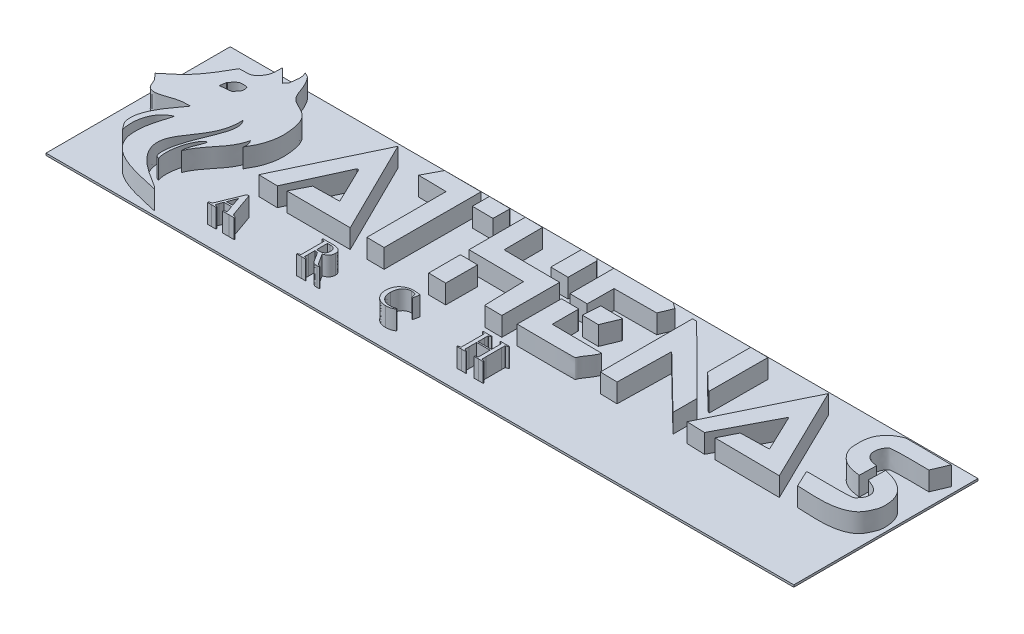
from build123d import *

# Parameters (mm, degrees)
RESSALTO_EXTRUS_O1_DEPTH = 100
ESBO_O2_W                = 3556.853307126
ESBO_O2_H                = 876
RESSALTO_EXTRUS_O2_DEPTH = 10


# Read off the part's stored shape, not the designer's step: Ressalto-extrusão1
with BuildPart() as part:
    # Ressalto-extrusão1 outline → Ressalto-extrusão1 (new body)
    # profile 1 of 19: a face of its own
    with BuildSketch(Plane(origin=(0, 0, 0), x_dir=(1, 0, 0), z_dir=(0, 1, 0))):
        Polygon((883, 903), (669, 455), (759, 453), (878, 713), (886, 714), (971, 538), (844, 536), (803, 455), (1105, 454), align=None)
    # profile 2 of 19: a face of its own
    with BuildSketch(Plane(origin=(0, 0, 0), x_dir=(1, 0, 0), z_dir=(0, 1, 0))):
        with BuildLine():
            Line((1878.015170723, 246.674179847), (1878.015170723, 282.090846514))
            Line((1878.015170723, 282.090846514), (1941.999545723, 282.090846514))
            Line((1941.999545723, 282.090846514), (1941.999545723, 246.674179847))
            add(Edge.make_bspline(
                [(1941.843295723, 228.44501318), (1941.871549038, 229.747058632), (1941.931253677, 232.498528782), (1941.978689804, 236.839000918), (1942.005544746, 241.613380188), (1942.001603698, 244.938064601), (1941.999545723, 246.674179847)],
                knots=[0, 0, 0, 0, 0.21431488, 0.45288818, 0.71430396, 1, 1, 1, 1], degree=3))
            add(Edge.make_bspline(
                [(1939.551629057, 225.32001318), (1939.884181692, 225.446781382), (1940.517257151, 225.688108105), (1941.282415936, 226.390246164), (1941.731302047, 227.351390915), (1941.804585515, 228.067006612), (1941.843295723, 228.44501318)],
                knots=[0, 0, 0, 0, 0.254504466, 0.484496332, 0.727697738, 1, 1, 1, 1], degree=3))
            Line((1939.551629057, 225.32001318), (1929.60371239, 222.090846514))
            Line((1929.60371239, 222.090846514), (1929.968295723, 218.75751318))
            add(Edge.make_bspline(
                [(1950.437045723, 219.017929847), (1946.990692238, 219.014077886), (1940.166762016, 219.006450836), (1933.344865738, 218.839932968), (1929.968295723, 218.75751318)],
                knots=[0, 0, 0, 0, 0.505039379, 1, 1, 1, 1], degree=3))
            add(Edge.make_bspline(
                [(1972.598504057, 218.75751318), (1968.813933778, 218.840074993), (1961.427641986, 219.001209705), (1954.039613895, 219.012449212), (1950.437045723, 219.017929847)],
                knots=[0, 0, 0, 0, 0.512377575, 1, 1, 1, 1], degree=3))
            Line((1972.598504057, 218.75751318), (1972.41621239, 222.090846514))
            Line((1972.41621239, 222.090846514), (1961.79121239, 225.424179847))
            add(Edge.make_bspline(
                [(1959.421420723, 228.21063818), (1959.460063252, 227.883491082), (1959.534090713, 227.256775664), (1960.011188337, 226.413944588), (1960.799141615, 225.790868198), (1961.443326431, 225.552765158), (1961.79121239, 225.424179847)],
                knots=[0, 0, 0, 0, 0.249515806, 0.477997218, 0.718097301, 1, 1, 1, 1], degree=3))
            add(Edge.make_bspline(
                [(1959.239129057, 246.075221514), (1959.233763758, 244.382481349), (1959.223445572, 241.127115351), (1959.294048758, 236.457192392), (1959.332148527, 232.194696579), (1959.392634458, 229.495317681), (1959.421420723, 228.21063818)],
                knots=[0, 0, 0, 0, 0.284234276, 0.546620572, 0.784229158, 1, 1, 1, 1], degree=3))
            Line((1959.239129057, 246.075221514), (1959.239129057, 318.939804847))
            add(Edge.make_bspline(
                [(1959.421420723, 333.861679847), (1959.3925923, 332.811385442), (1959.331368133, 330.580829909), (1959.294035389, 327.038729626), (1959.223258914, 323.115380094), (1959.233685187, 320.372135295), (1959.239129057, 318.939804847)],
                knots=[0, 0, 0, 0, 0.21121017, 0.448556149, 0.712074614, 1, 1, 1, 1], degree=3))
            add(Edge.make_bspline(
                [(1961.530795723, 336.908554847), (1961.221936578, 336.781972542), (1960.620011599, 336.535280636), (1959.953829398, 335.808951181), (1959.502440935, 334.905961746), (1959.449503336, 334.223640943), (1959.421420723, 333.861679847)],
                knots=[0, 0, 0, 0, 0.249768632, 0.486765506, 0.727736691, 1, 1, 1, 1], degree=3))
            Line((1961.530795723, 336.908554847), (1972.598504057, 340.424179847))
            Line((1972.598504057, 340.424179847), (1972.233920723, 343.75751318))
            add(Edge.make_bspline(
                [(1950.801629057, 343.418971514), (1954.326160708, 343.430597377), (1961.471658149, 343.454167198), (1968.614367694, 343.655492173), (1972.233920723, 343.75751318)],
                knots=[0, 0, 0, 0, 0.493252105, 1, 1, 1, 1], degree=3))
            add(Edge.make_bspline(
                [(1929.60371239, 343.75751318), (1933.162498292, 343.655501842), (1940.227044377, 343.452999129), (1947.29444989, 343.430257153), (1950.801629057, 343.418971514)],
                knots=[0, 0, 0, 0, 0.503752946, 1, 1, 1, 1], degree=3))
            Line((1929.60371239, 343.75751318), (1929.786004057, 340.424179847))
            Line((1929.786004057, 340.424179847), (1939.551629057, 337.27313818))
            add(Edge.make_bspline(
                [(1941.843295723, 334.486679847), (1941.805316282, 334.830834308), (1941.733448231, 335.482073756), (1941.269748922, 336.347517962), (1940.500443038, 336.955213244), (1939.881956831, 337.162453221), (1939.551629057, 337.27313818)],
                knots=[0, 0, 0, 0, 0.264628268, 0.500752965, 0.733356767, 1, 1, 1, 1], degree=3))
            add(Edge.make_bspline(
                [(1941.999545723, 319.278346514), (1942.001518322, 320.684600846), (1942.005341795, 323.410332243), (1941.97872342, 327.351398556), (1941.929887404, 331.0147869), (1941.871439637, 333.358249805), (1941.843295723, 334.486679847)],
                knots=[0, 0, 0, 0, 0.277372475, 0.537628824, 0.77735789, 1, 1, 1, 1], degree=3))
            Line((1941.999545723, 319.278346514), (1941.999545723, 288.75751318))
            Line((1941.999545723, 288.75751318), (1878.015170723, 288.75751318))
            Line((1878.015170723, 288.75751318), (1878.015170723, 319.278346514))
            add(Edge.make_bspline(
                [(1878.19746239, 334.486679847), (1878.168710041, 333.358255809), (1878.108998708, 331.014805373), (1878.070490433, 327.351229449), (1877.999772761, 323.410512657), (1878.009930385, 320.684633094), (1878.015170723, 319.278346514)],
                knots=[0, 0, 0, 0, 0.222638348, 0.462363364, 0.722632212, 1, 1, 1, 1], degree=3))
            add(Edge.make_bspline(
                [(1880.489129057, 337.27313818), (1880.158801282, 337.162453221), (1879.540315075, 336.955213244), (1878.771009191, 336.347517962), (1878.307309883, 335.482073756), (1878.235441831, 334.830834308), (1878.19746239, 334.486679847)],
                knots=[0, 0, 0, 0, 0.266643233, 0.499247035, 0.735371732, 1, 1, 1, 1], degree=3))
            Line((1880.489129057, 337.27313818), (1890.515170723, 340.424179847))
            Line((1890.515170723, 340.424179847), (1890.07246239, 343.75751318))
            add(Edge.make_bspline(
                [(1869.239129057, 343.418971514), (1872.737647899, 343.429386503), (1879.68359611, 343.45006439), (1886.626529396, 343.655534013), (1890.07246239, 343.75751318)],
                knots=[0, 0, 0, 0, 0.503677646, 1, 1, 1, 1], degree=3))
            add(Edge.make_bspline(
                [(1847.442254057, 343.75751318), (1851.148617326, 343.655483408), (1858.412903448, 343.455510172), (1865.679885691, 343.430984008), (1869.239129057, 343.418971514)],
                knots=[0, 0, 0, 0, 0.510217137, 1, 1, 1, 1], degree=3))
            Line((1847.442254057, 343.75751318), (1847.624545723, 340.424179847))
            Line((1847.624545723, 340.424179847), (1858.50996239, 336.908554847))
            add(Edge.make_bspline(
                [(1860.61933739, 333.861679847), (1860.591254777, 334.223640943), (1860.538317178, 334.905961746), (1860.086928715, 335.808951181), (1859.420746514, 336.535280636), (1858.818821535, 336.781972542), (1858.50996239, 336.908554847)],
                knots=[0, 0, 0, 0, 0.272263309, 0.513234494, 0.750231368, 1, 1, 1, 1], degree=3))
            add(Edge.make_bspline(
                [(1860.801629057, 318.939804847), (1860.807072926, 320.372135295), (1860.817499199, 323.115380094), (1860.746722724, 327.038729626), (1860.709389981, 330.580829909), (1860.648165814, 332.811385442), (1860.61933739, 333.861679847)],
                knots=[0, 0, 0, 0, 0.287925386, 0.551443851, 0.78878983, 1, 1, 1, 1], degree=3))
            Line((1860.801629057, 318.939804847), (1860.801629057, 246.075221514))
            add(Edge.make_bspline(
                [(1860.61933739, 228.21063818), (1860.648123655, 229.495317681), (1860.708609586, 232.194696579), (1860.746709355, 236.457192392), (1860.817312541, 241.127115351), (1860.806994355, 244.382481349), (1860.801629057, 246.075221514)],
                knots=[0, 0, 0, 0, 0.215770842, 0.453379428, 0.715765724, 1, 1, 1, 1], degree=3))
            add(Edge.make_bspline(
                [(1858.249545723, 225.424179847), (1858.597431682, 225.552765158), (1859.241616498, 225.790868198), (1860.029569776, 226.413944588), (1860.506667401, 227.256775664), (1860.580694861, 227.883491082), (1860.61933739, 228.21063818)],
                knots=[0, 0, 0, 0, 0.281902699, 0.522002782, 0.750484194, 1, 1, 1, 1], degree=3))
            Line((1858.249545723, 225.424179847), (1847.442254057, 222.090846514))
            Line((1847.442254057, 222.090846514), (1847.780795723, 218.75751318))
            add(Edge.make_bspline(
                [(1869.577670723, 219.017929847), (1866.01850038, 219.012644276), (1858.751977944, 219.001853075), (1851.487238262, 218.840059597), (1847.780795723, 218.75751318)],
                knots=[0, 0, 0, 0, 0.489803806, 1, 1, 1, 1], degree=3))
            add(Edge.make_bspline(
                [(1890.515170723, 218.75751318), (1887.025749337, 218.839978861), (1880.047554139, 219.004894917), (1873.067415943, 219.013585139), (1869.577670723, 219.017929847)],
                knots=[0, 0, 0, 0, 0.5000464, 1, 1, 1, 1], degree=3))
            Line((1890.515170723, 218.75751318), (1890.22871239, 222.090846514))
            Line((1890.22871239, 222.090846514), (1880.489129057, 225.32001318))
            add(Edge.make_bspline(
                [(1878.19746239, 228.44501318), (1878.236172598, 228.067006612), (1878.309456066, 227.351390915), (1878.758342178, 226.390246164), (1879.523500962, 225.688108105), (1880.156576422, 225.446781382), (1880.489129057, 225.32001318)],
                knots=[0, 0, 0, 0, 0.272302262, 0.515503668, 0.745495534, 1, 1, 1, 1], degree=3))
            add(Edge.make_bspline(
                [(1878.015170723, 246.674179847), (1878.009719055, 244.938036784), (1877.999278814, 241.613227949), (1878.070421684, 236.83914054), (1878.107733217, 232.498514264), (1878.168640135, 229.747053969), (1878.19746239, 228.44501318)],
                knots=[0, 0, 0, 0, 0.285692695, 0.547117122, 0.785687629, 1, 1, 1, 1], degree=3))
        make_face()
    # profile 3 of 19: a face of its own
    with BuildSketch(Plane(origin=(0, 0, 0), x_dir=(1, 0, 0), z_dir=(0, 1, 0))):
        with BuildLine():
            Line((1538.679570268, 313.418971514), (1542.195195268, 313.965846514))
            Line((1542.195195268, 313.965846514), (1547.637903601, 342.715846514))
            Line((1547.637903601, 342.715846514), (1547.012903601, 343.44501318))
            add(Edge.make_bspline(
                [(1516.622278601, 347.090846514), (1519.115083042, 347.043046842), (1524.13560967, 346.946777947), (1531.700997682, 346.243106718), (1539.35364026, 345.107830761), (1544.440260002, 344.003531254), (1547.012903601, 343.44501318)],
                knots=[0, 0, 0, 0, 0.243796665, 0.491008291, 0.742568871, 1, 1, 1, 1], degree=3))
            add(Edge.make_bspline(
                [(1446.335820268, 280.892929847), (1446.394883543, 283.378447284), (1446.510122958, 288.227984944), (1447.435870547, 295.301894795), (1448.961089063, 301.980577948), (1451.129062736, 308.257334025), (1453.89991718, 314.143789778), (1457.312611957, 319.612714829), (1461.321019589, 324.704179154), (1465.935302996, 329.346067018), (1471.018311539, 333.517802354), (1476.48976503, 337.171579356), (1482.337367658, 340.210872157), (1488.50619859, 342.763198117), (1495.044032894, 344.710776624), (1501.932041727, 346.077619852), (1509.161715247, 346.929205575), (1514.102527999, 347.036253471), (1516.622278601, 347.090846514)],
                knots=[0, 0, 0, 0, 0.06853161, 0.133713253, 0.196375687, 0.257173194, 0.316502542, 0.375429113, 0.434580918, 0.494848644, 0.55557446, 0.615666939, 0.675957486, 0.737044672, 0.799532613, 0.86376334, 0.930521066, 1, 1, 1, 1], degree=3))
            add(Edge.make_bspline(
                [(1510.554570268, 217.090846514), (1508.243298555, 217.148541016), (1503.710545208, 217.261688658), (1497.073664014, 218.070450106), (1490.768347283, 219.447107204), (1484.799440009, 221.389603521), (1479.130989251, 223.834816503), (1473.801551918, 226.873094939), (1468.800446799, 230.460198921), (1464.182499392, 234.569060032), (1459.989849637, 239.11254026), (1456.325018061, 244.050654407), (1453.2410227, 249.349667922), (1450.690536752, 254.980859797), (1448.749185883, 260.977874575), (1447.341450398, 267.306216223), (1446.497705604, 273.986483515), (1446.390611354, 278.555400654), (1446.335820268, 280.892929847)],
                knots=[0, 0, 0, 0, 0.068091714, 0.133538147, 0.196650532, 0.257959557, 0.31820952, 0.378231045, 0.43834949, 0.499223778, 0.560043236, 0.620200297, 0.68003407, 0.740361072, 0.801992546, 0.86540996, 0.931141639, 1, 1, 1, 1], degree=3))
            add(Edge.make_bspline(
                [(1549.747278601, 228.36688818), (1548.292848223, 227.468105227), (1545.397975418, 225.679183345), (1540.838591859, 223.39247524), (1536.145593813, 221.425537738), (1531.293442597, 219.838240062), (1526.30251896, 218.619117446), (1521.179757587, 217.725860736), (1515.912799237, 217.20088493), (1512.352599517, 217.127771455), (1510.554570268, 217.090846514)],
                knots=[0, 0, 0, 0, 0.123953266, 0.246714413, 0.369483633, 0.492723333, 0.616561425, 0.741803105, 0.869601256, 1, 1, 1, 1], degree=3))
            Line((1549.747278601, 228.36688818), (1548.783736934, 232.090846514))
            add(Edge.make_bspline(
                [(1519.330611934, 227.090846514), (1521.694832729, 227.152423132), (1526.501846613, 227.2776228), (1533.795922111, 228.277108937), (1541.281432443, 229.811484572), (1546.250841142, 231.321298133), (1548.783736934, 232.090846514)],
                knots=[0, 0, 0, 0, 0.236425849, 0.480709052, 0.735318639, 1, 1, 1, 1], degree=3))
            add(Edge.make_bspline(
                [(1466.335820268, 284.043971514), (1466.368907658, 281.932497675), (1466.433629961, 277.802239996), (1467.140726436, 271.779286977), (1468.210291444, 266.076358162), (1469.755129184, 260.706282805), (1471.726764335, 255.657270459), (1474.172430133, 250.948530532), (1477.008267028, 246.534501222), (1480.320815876, 242.516971421), (1483.992776055, 238.870076977), (1488.045994474, 235.715808456), (1492.431803849, 233.023805286), (1497.173798479, 230.874100199), (1502.234321517, 229.171650299), (1507.633455321, 227.951126654), (1513.372526259, 227.21262978), (1517.31448037, 227.132056241), (1519.330611934, 227.090846514)],
                knots=[0, 0, 0, 0, 0.071933868, 0.140709965, 0.206394407, 0.269508485, 0.330877952, 0.390821605, 0.450071989, 0.509358559, 0.567938108, 0.626115806, 0.684012213, 0.742925534, 0.803178701, 0.86569285, 0.931307956, 1, 1, 1, 1], degree=3))
            add(Edge.make_bspline(
                [(1512.481653601, 338.75751318), (1510.733891306, 338.718065359), (1507.317843445, 338.640963543), (1502.348529678, 337.876373879), (1497.649707859, 336.728223162), (1493.239174973, 335.052102685), (1489.135957467, 332.868333706), (1485.290998301, 330.252346162), (1481.762980565, 327.12442557), (1478.554134045, 323.554212878), (1475.649894146, 319.633987787), (1473.200128084, 315.35169825), (1471.027474226, 310.844605502), (1469.332246129, 306.015092132), (1467.953387535, 300.927867061), (1467.061058642, 295.543426717), (1466.41534049, 289.892905913), (1466.3627555, 286.025133055), (1466.335820268, 284.043971514)],
                knots=[0, 0, 0, 0, 0.064984085, 0.127013122, 0.186625522, 0.244690157, 0.302048039, 0.35920369, 0.417327582, 0.477009063, 0.537538362, 0.598473028, 0.660307519, 0.723443352, 0.788625386, 0.856167663, 0.926325794, 1, 1, 1, 1], degree=3))
            add(Edge.make_bspline(
                [(1532.247278601, 336.075221514), (1530.480744844, 336.48766324), (1527.04319915, 337.290244721), (1521.960943413, 338.09892105), (1517.13891823, 338.673551981), (1514.002304635, 338.730098873), (1512.481653601, 338.75751318)],
                knots=[0, 0, 0, 0, 0.272119475, 0.529524628, 0.771910425, 1, 1, 1, 1], degree=3))
            Line((1532.247278601, 336.075221514), (1538.679570268, 313.418971514))
        make_face()
    # profile 4 of 19: a face of its own
    with BuildSketch(Plane(origin=(0, 0, 0), x_dir=(1, 0, 0), z_dir=(0, 1, 0))):
        with BuildLine():
            add(Edge.make_bspline(
                [(1115.292871132, 245.346054847), (1115.301926797, 243.696751535), (1115.319132586, 240.563070418), (1115.337846767, 236.101136451), (1115.387705082, 232.090519709), (1115.447028034, 229.564764144), (1115.475162798, 228.36688818)],
                knots=[0, 0, 0, 0, 0.291392183, 0.553645999, 0.788310185, 1, 1, 1, 1], degree=3))
            Line((1115.292871132, 245.346054847), (1115.292871132, 275.580429847))
            Line((1115.292871132, 275.580429847), (1121.594954465, 275.424179847))
            add(Edge.make_bspline(
                [(1132.558496132, 269.07001318), (1132.139108325, 269.68207724), (1131.390832693, 270.774127637), (1130.290396041, 272.208854111), (1129.284079099, 273.356229103), (1128.156216558, 274.185249184), (1126.883255672, 274.780869351), (1125.396508013, 275.133897058), (1123.613302779, 275.323722369), (1122.315908628, 275.388296429), (1121.594954465, 275.424179847)],
                knots=[0, 0, 0, 0, 0.164686996, 0.293836072, 0.401580084, 0.502192456, 0.602212332, 0.711598774, 0.839737165, 1, 1, 1, 1], degree=3))
            add(Edge.make_bspline(
                [(1164.329329465, 223.002304847), (1163.694495012, 223.476435569), (1162.380229689, 224.458004171), (1160.528476474, 226.228370466), (1158.720489962, 228.298041939), (1156.219067746, 231.487945766), (1153.158336741, 236.045563874), (1149.363821047, 241.968872083), (1145.446740492, 248.428204849), (1141.384184752, 255.252156203), (1137.16965, 262.241551431), (1134.097430038, 266.791071377), (1132.558496132, 269.07001318)],
                knots=[0, 0, 0, 0, 0.042266959, 0.087503125, 0.136413548, 0.188882247, 0.30379449, 0.429250458, 0.564431838, 0.707000012, 0.853230686, 1, 1, 1, 1], degree=3))
            add(Edge.make_bspline(
                [(1183.105371132, 218.75751318), (1181.976990727, 218.773042469), (1179.858615734, 218.802196516), (1176.866659344, 218.870697745), (1174.230427291, 219.134353548), (1171.87967977, 219.532641644), (1169.78050468, 220.154011253), (1167.836066063, 220.871624877), (1166.030454241, 221.840281322), (1164.904053929, 222.609715569), (1164.329329465, 223.002304847)],
                knots=[0, 0, 0, 0, 0.172540607, 0.323920644, 0.457290372, 0.57729378, 0.687760602, 0.791519124, 0.893626574, 1, 1, 1, 1], degree=3))
            add(Edge.make_bspline(
                [(1193.730371132, 219.330429847), (1192.715331298, 219.23502648), (1190.782556686, 219.053365425), (1187.992406135, 218.926543075), (1185.468294715, 218.760976621), (1183.860823162, 218.75862048), (1183.105371132, 218.75751318)],
                knots=[0, 0, 0, 0, 0.28729657, 0.547051946, 0.787131208, 1, 1, 1, 1], degree=3))
            Line((1193.730371132, 219.330429847), (1193.469954465, 222.090846514))
            add(Edge.make_bspline(
                [(1179.954329465, 228.783554847), (1180.441923701, 228.30709097), (1181.384377034, 227.386151105), (1182.880608708, 226.165786804), (1184.432202894, 225.173481507), (1186.042345715, 224.34185073), (1187.750868096, 223.728147172), (1189.516930949, 223.091918416), (1191.443170039, 222.593905819), (1192.775345426, 222.263252388), (1193.469954465, 222.090846514)],
                knots=[0, 0, 0, 0, 0.133306653, 0.257663627, 0.376812079, 0.492983951, 0.6112217, 0.731489845, 0.859996227, 1, 1, 1, 1], degree=3))
            add(Edge.make_bspline(
                [(1146.438704465, 279.017929847), (1148.296664084, 276.260297669), (1151.920343361, 270.881938271), (1156.901841092, 262.8618219), (1161.571921027, 255.368644969), (1165.234210781, 249.488930211), (1168.012089023, 245.136616466), (1169.967142707, 242.148588685), (1171.811661531, 239.341954014), (1173.542277701, 236.724304947), (1175.233481377, 234.366739018), (1176.832709867, 232.244341513), (1178.405530506, 230.415446524), (1179.455411401, 229.309239753), (1179.954329465, 228.783554847)],
                knots=[0, 0, 0, 0, 0.164993408, 0.32179558, 0.468460144, 0.603161316, 0.665538051, 0.724680569, 0.780356486, 0.832208226, 0.880381188, 0.924321707, 0.964036618, 1, 1, 1, 1], degree=3))
            add(Edge.make_bspline(
                [(1175.292871132, 313.497096514), (1175.274874983, 312.411268619), (1175.239510339, 310.277483374), (1174.903039185, 307.157093765), (1174.312283018, 304.204662818), (1173.584410786, 301.391223875), (1172.547578853, 298.76081548), (1171.331016902, 296.264892699), (1169.858210023, 293.945718741), (1168.18987584, 291.76162368), (1166.259872499, 289.758416344), (1164.139912199, 287.837211555), (1161.774893424, 286.043105501), (1159.146151153, 284.406875738), (1156.306283707, 282.877448069), (1153.245769413, 281.431645183), (1149.938065206, 280.132166398), (1147.623809097, 279.395280739), (1146.438704465, 279.017929847)],
                knots=[0, 0, 0, 0, 0.066648492, 0.130972477, 0.192322563, 0.251401682, 0.309099439, 0.365583418, 0.421620656, 0.477475148, 0.53401943, 0.592129179, 0.65298893, 0.715974451, 0.78202584, 0.850922516, 0.92365909, 1, 1, 1, 1], degree=3))
            add(Edge.make_bspline(
                [(1134.303287798, 343.75751318), (1135.961977135, 343.732335216), (1139.17070354, 343.683628568), (1143.822811774, 343.315461535), (1148.154572981, 342.723241353), (1152.174483207, 341.909380404), (1155.866296045, 340.810414452), (1159.241385745, 339.483981726), (1162.31499531, 337.935344008), (1165.032288032, 336.091308762), (1167.459973602, 334.055895753), (1169.551435335, 331.773633523), (1171.344091736, 329.277864804), (1172.813071496, 326.550514888), (1173.935685715, 323.589292396), (1174.695105541, 320.410458738), (1175.220199841, 317.030031549), (1175.268186387, 314.697152282), (1175.292871132, 313.497096514)],
                knots=[0, 0, 0, 0, 0.085871209, 0.166117433, 0.241436107, 0.312127298, 0.378249033, 0.440592444, 0.499687396, 0.556029941, 0.610238405, 0.663357187, 0.715864025, 0.768950475, 0.823289199, 0.879317174, 0.937919581, 1, 1, 1, 1], degree=3))
            Line((1134.303287798, 343.75751318), (1121.100162798, 343.75751318))
            add(Edge.make_bspline(
                [(1107.532454465, 343.418971514), (1108.348525637, 343.423214415), (1110.1722049, 343.432696052), (1113.226881604, 343.560042191), (1116.932409941, 343.702618426), (1119.632967055, 343.738188294), (1121.100162798, 343.75751318)],
                knots=[0, 0, 0, 0, 0.180367081, 0.403067425, 0.675690276, 1, 1, 1, 1], degree=3))
            add(Edge.make_bspline(
                [(1085.266829465, 343.75751318), (1089.007918708, 343.655500434), (1096.428438932, 343.45315625), (1103.851676233, 343.430303129), (1107.532454465, 343.418971514)],
                knots=[0, 0, 0, 0, 0.504154578, 1, 1, 1, 1], degree=3))
            Line((1085.266829465, 343.75751318), (1085.449121132, 340.424179847))
            Line((1085.449121132, 340.424179847), (1096.334537798, 336.908554847))
            add(Edge.make_bspline(
                [(1098.443912798, 333.861679847), (1098.415830185, 334.223640943), (1098.362892587, 334.905961746), (1097.911504124, 335.808951181), (1097.245321923, 336.535280636), (1096.643396944, 336.781972542), (1096.334537798, 336.908554847)],
                knots=[0, 0, 0, 0, 0.272263309, 0.513234494, 0.750231368, 1, 1, 1, 1], degree=3))
            add(Edge.make_bspline(
                [(1098.626204465, 318.939804847), (1098.631789045, 320.38949756), (1098.642390161, 323.141425214), (1098.571422372, 327.064773172), (1098.533661307, 330.589505598), (1098.47272006, 332.811385179), (1098.443912798, 333.861679847)],
                knots=[0, 0, 0, 0, 0.291415291, 0.553188817, 0.788789903, 1, 1, 1, 1], degree=3))
            Line((1098.626204465, 318.939804847), (1098.626204465, 246.075221514))
            add(Edge.make_bspline(
                [(1098.443912798, 228.21063818), (1098.472708042, 229.477955874), (1098.533449865, 232.151285762), (1098.571449006, 236.387747082), (1098.642158467, 241.075030189), (1098.631688547, 244.3564389), (1098.626204465, 246.075221514)],
                knots=[0, 0, 0, 0, 0.212856073, 0.449006989, 0.711393096, 1, 1, 1, 1], degree=3))
            add(Edge.make_bspline(
                [(1096.074121132, 225.424179847), (1096.404665161, 225.544818485), (1097.032331318, 225.773897771), (1097.799291446, 226.395327473), (1098.311000527, 227.232470719), (1098.398095641, 227.873446946), (1098.443912798, 228.21063818)],
                knots=[0, 0, 0, 0, 0.268089007, 0.509071053, 0.741742469, 1, 1, 1, 1], degree=3))
            Line((1096.074121132, 225.424179847), (1085.266829465, 222.090846514))
            Line((1085.266829465, 222.090846514), (1085.605371132, 218.75751318))
            add(Edge.make_bspline(
                [(1107.141829465, 219.017929847), (1103.61737827, 219.012742241), (1096.437646744, 219.002174462), (1089.259728368, 218.840051675), (1085.605371132, 218.75751318)],
                knots=[0, 0, 0, 0, 0.490888995, 1, 1, 1, 1], degree=3))
            add(Edge.make_bspline(
                [(1127.792871132, 218.75751318), (1124.329493378, 218.840005517), (1117.446781764, 219.003941132), (1110.562128125, 219.013286877), (1107.141829465, 219.017929847)],
                knots=[0, 0, 0, 0, 0.503199603, 1, 1, 1, 1], degree=3))
            Line((1127.792871132, 218.75751318), (1127.506412798, 222.090846514))
            Line((1127.506412798, 222.090846514), (1117.766829465, 224.955429847))
            add(Edge.make_bspline(
                [(1115.475162798, 228.36688818), (1115.51287209, 227.953954158), (1115.583617246, 227.179262273), (1116.034875694, 226.14159359), (1116.778356228, 225.347187349), (1117.43122438, 225.08843882), (1117.766829465, 224.955429847)],
                knots=[0, 0, 0, 0, 0.280856458, 0.526905527, 0.756807082, 1, 1, 1, 1], degree=3))
        make_face()
        with BuildLine():
            add(Edge.make_bspline(
                [(1115.292871132, 284.017929847), (1117.046128719, 283.948712128), (1120.413013398, 283.815789232), (1123.782272656, 283.776393934), (1125.397037798, 283.75751318)],
                knots=[0, 0, 0, 0, 0.52073586, 1, 1, 1, 1], degree=3))
            Line((1115.292871132, 284.017929847), (1115.292871132, 334.721054847))
            add(Edge.make_bspline(
                [(1126.829329465, 335.424179847), (1125.96980506, 335.411718476), (1124.180475742, 335.385776807), (1121.402178715, 335.246434334), (1118.413906342, 335.045410437), (1116.359994519, 334.831956331), (1115.292871132, 334.721054847)],
                knots=[0, 0, 0, 0, 0.223017818, 0.464271075, 0.721658516, 1, 1, 1, 1], degree=3))
            add(Edge.make_bspline(
                [(1155.292871132, 310.111679847), (1155.277402034, 311.171877369), (1155.247392339, 313.22863634), (1154.888339713, 316.194598335), (1154.388116523, 318.954569072), (1153.64004269, 321.492523946), (1152.639619427, 323.788704415), (1151.468208226, 325.885312229), (1150.04608583, 327.741169132), (1148.418677503, 329.404798803), (1146.550118755, 330.846610884), (1144.442208213, 332.070746614), (1142.102908259, 333.116710017), (1139.521381722, 333.972991022), (1136.68511506, 334.614975944), (1133.612345103, 335.074536965), (1130.29832572, 335.36374395), (1128.010499746, 335.403601824), (1126.829329465, 335.424179847)],
                knots=[0, 0, 0, 0, 0.072331686, 0.140321818, 0.203659703, 0.263652261, 0.320451949, 0.374326436, 0.427184364, 0.479561815, 0.532780552, 0.587761447, 0.645581267, 0.707418407, 0.773107569, 0.843838994, 0.919376412, 1, 1, 1, 1], degree=3))
            add(Edge.make_bspline(
                [(1125.397037798, 283.75751318), (1126.647551133, 283.778698232), (1129.065200634, 283.819655835), (1132.554920391, 284.098546553), (1135.785651305, 284.588681645), (1138.753885587, 285.291086113), (1141.481478662, 286.165264319), (1143.948796924, 287.257928673), (1146.14711115, 288.566890739), (1148.112965543, 290.063060899), (1149.812635471, 291.797925302), (1151.286770034, 293.752096366), (1152.54452536, 295.926421048), (1153.55534056, 298.335375354), (1154.331913496, 300.966439767), (1154.903819243, 303.81496697), (1155.242732695, 306.891640511), (1155.275827096, 309.017061216), (1155.292871132, 310.111679847)],
                knots=[0, 0, 0, 0, 0.081605276, 0.157769572, 0.228273606, 0.294639421, 0.356622281, 0.41494546, 0.470322065, 0.523236111, 0.575711686, 0.628281963, 0.682596601, 0.739202578, 0.798345327, 0.861337315, 0.928586958, 1, 1, 1, 1], degree=3))
        make_face(mode=Mode.SUBTRACT)
    # profile 5 of 19: a face of its own
    with BuildSketch(Plane(origin=(0, 0, 0), x_dir=(1, 0, 0), z_dir=(0, 1, 0))):
        with BuildLine():
            Line((693.626956929, 242.19501318), (699.876956929, 258.75751318))
            Line((699.876956929, 258.75751318), (735.892581929, 258.75751318))
            Line((735.892581929, 258.75751318), (741.699873596, 242.19501318))
            add(Edge.make_bspline(
                [(745.137373596, 230.00751318), (745.090350641, 230.696992223), (744.982711887, 232.275256837), (744.365718341, 234.313422265), (743.723450222, 236.263165974), (743.180673429, 238.050605392), (742.44189949, 240.037639292), (741.957030248, 241.447353225), (741.699873596, 242.19501318)],
                knots=[0, 0, 0, 0, 0.162745376, 0.372535279, 0.499576539, 0.648012408, 0.813318843, 1, 1, 1, 1], degree=3))
            add(Edge.make_bspline(
                [(741.777998596, 226.309596514), (742.297930403, 226.486771653), (743.207324541, 226.796662357), (744.38789056, 227.523855481), (745.047970009, 228.674590125), (745.105945613, 229.538951638), (745.137373596, 230.00751318)],
                knots=[0, 0, 0, 0, 0.302069079, 0.528338228, 0.744316974, 1, 1, 1, 1], degree=3))
            Line((741.777998596, 226.309596514), (733.080081929, 223.75751318))
            Line((733.080081929, 223.75751318), (733.522790262, 218.75751318))
            add(Edge.make_bspline(
                [(764.564456929, 219.017929847), (759.32996711, 219.014157861), (748.982074444, 219.006701145), (738.635527916, 218.83992532), (733.522790262, 218.75751318)],
                knots=[0, 0, 0, 0, 0.505850803, 1, 1, 1, 1], degree=3))
            add(Edge.make_bspline(
                [(788.470706929, 218.75751318), (784.50383504, 218.839959541), (776.535945616, 219.005561935), (768.566337495, 219.013795449), (764.564456929, 219.017929847)],
                knots=[0, 0, 0, 0, 0.497857297, 1, 1, 1, 1], degree=3))
            Line((788.470706929, 218.75751318), (788.184248596, 223.75751318))
            Line((788.184248596, 223.75751318), (779.590498596, 226.309596514))
            add(Edge.make_bspline(
                [(770.449873596, 237.793971514), (770.795666332, 236.843939031), (771.429985761, 235.10120705), (772.44395536, 232.755069667), (773.413489827, 230.913734275), (774.355856564, 229.481020379), (775.409491181, 228.398490798), (776.624392415, 227.541601729), (778.02993129, 226.826651894), (779.05555711, 226.486836145), (779.590498596, 226.309596514)],
                knots=[0, 0, 0, 0, 0.196915223, 0.361219708, 0.497386878, 0.601976815, 0.69404928, 0.789775617, 0.890352074, 1, 1, 1, 1], degree=3))
            Line((770.449873596, 237.793971514), (732.559248596, 345.16376318))
            Line((732.559248596, 345.16376318), (723.080081929, 343.75751318))
            Line((723.080081929, 343.75751318), (679.304040262, 236.64813818))
            add(Edge.make_bspline(
                [(670.866540262, 226.596054847), (671.392833922, 226.772992552), (672.394361455, 227.109701877), (673.761276088, 227.819385253), (674.896572982, 228.715858563), (675.84868512, 229.80840882), (676.649190903, 231.150444693), (677.517448889, 232.718249488), (678.415264721, 234.581424563), (678.99692408, 235.933985768), (679.304040262, 236.64813818)],
                knots=[0, 0, 0, 0, 0.121575386, 0.231355811, 0.335641575, 0.436755744, 0.547062381, 0.677331929, 0.829631235, 1, 1, 1, 1], degree=3))
            Line((670.866540262, 226.596054847), (661.465498596, 223.75751318))
            Line((661.465498596, 223.75751318), (661.908206929, 218.75751318))
            add(Edge.make_bspline(
                [(680.970706929, 219.017929847), (679.52975612, 219.007587651), (676.552373166, 218.986217957), (671.933626562, 218.986083221), (667.021208068, 218.852076638), (663.644356962, 218.789622767), (661.908206929, 218.75751318)],
                knots=[0, 0, 0, 0, 0.226752763, 0.468530783, 0.726754224, 1, 1, 1, 1], degree=3))
            add(Edge.make_bspline(
                [(701.699873596, 218.75751318), (699.67725774, 218.788929882), (695.831621341, 218.848663028), (690.354937307, 218.984801464), (685.467173331, 218.985821778), (682.402981238, 219.007702358), (680.970706929, 219.017929847)],
                knots=[0, 0, 0, 0, 0.292727973, 0.55656903, 0.792730101, 1, 1, 1, 1], degree=3))
            Line((701.699873596, 218.75751318), (701.439456929, 223.75751318))
            Line((701.439456929, 223.75751318), (693.001956929, 226.231471514))
            add(Edge.make_bspline(
                [(689.746748596, 229.77313818), (689.782713868, 229.331756269), (689.849866447, 228.507629791), (690.476534587, 227.385534811), (691.623648749, 226.678454001), (692.508489198, 226.391502077), (693.001956929, 226.231471514)],
                knots=[0, 0, 0, 0, 0.250937472, 0.468538038, 0.703608341, 1, 1, 1, 1], degree=3))
            add(Edge.make_bspline(
                [(693.626956929, 242.19501318), (693.342364713, 241.421753441), (692.801606165, 239.952469352), (692.009447832, 237.888222513), (691.364368767, 236.039325554), (690.778550252, 234.435480213), (690.323488768, 233.021799737), (690.017920086, 231.784896468), (689.774793929, 230.728718922), (689.755440771, 230.069304232), (689.746748596, 229.77313818)],
                knots=[0, 0, 0, 0, 0.189300127, 0.359692417, 0.507928746, 0.639128232, 0.752030464, 0.848768992, 0.932076899, 1, 1, 1, 1], degree=3))
        make_face()
        with BuildLine():
            add(Edge.make_bspline(
                [(721.934248596, 299.356471514), (721.402973174, 301.022582512), (720.368745784, 304.265980486), (719.354544878, 307.515695736), (718.861331929, 309.096054847)],
                knots=[0, 0, 0, 0, 0.51369305, 1, 1, 1, 1], degree=3))
            Line((721.934248596, 299.356471514), (732.741540262, 267.090846514))
            Line((732.741540262, 267.090846514), (703.392581929, 267.090846514))
            Line((703.392581929, 267.090846514), (715.423831929, 299.434596514))
            add(Edge.make_bspline(
                [(718.861331929, 309.096054847), (718.320928385, 307.513892562), (717.215973831, 304.278870433), (716.029852982, 301.072710093), (715.423831929, 299.434596514)],
                knots=[0, 0, 0, 0, 0.489073095, 1, 1, 1, 1], degree=3))
        make_face(mode=Mode.SUBTRACT)
    # profile 6 of 19: a face of its own
    with BuildSketch(Plane(origin=(0, 0, 0), x_dir=(1, 0, 0), z_dir=(0, 1, 0))):
        with BuildLine():
            Line((3195, 533), (3232, 455))
            add(Edge.make_bspline(
                [(3232, 455), (3302.270926394, 453.893371238), (3398.537717419, 439.942889032), (3466, 479), (3491.492052863, 493.75855692), (3502.243156147, 516.574732712), (3513, 542), (3523.188971695, 566.083024005), (3521.841675376, 587.548900631), (3518, 613), (3507.156919452, 684.835408629), (3439.830183902, 714.631311589), (3378, 728)],
                knots=[0, 0, 0, 0, 1, 1, 1, 2, 2, 2, 3, 3, 3, 4, 4, 4, 4], degree=3))
            Line((3378, 728), (3376, 647))
            add(Edge.make_bspline(
                [(3376, 647), (3408.351149659, 634.059540136), (3449.824007769, 621.120038843), (3441, 577), (3439.450255053, 569.251275263), (3435.01248387, 562.108964716), (3430, 556), (3424.151889799, 548.872615692), (3418.185476111, 538.791851389), (3409, 538), (3338.92341677, 531.958915239), (3268.317302359, 537.642927625), (3198, 536), (3196.586172289, 535.966966642), (3196, 534), (3195, 533)],
                knots=[0, 0, 0, 0, 1, 1, 1, 2, 2, 2, 3, 3, 3, 4, 4, 4, 5, 5, 5, 5], degree=3))
        make_face()
    # profile 7 of 19: a face of its own
    with BuildSketch(Plane(origin=(0, 0, 0), x_dir=(1, 0, 0), z_dir=(0, 1, 0))):
        with BuildLine():
            Line((3479, 832), (3511, 907))
            add(Edge.make_bspline(
                [(3511, 907), (3439.666666667, 907.666666667), (3368.330164334, 909.946860589), (3297, 909), (3286.387337589, 908.85912395), (3258.839499891, 893.203967309), (3252, 888), (3201.198013087, 849.346314306), (3197.43384748, 806.624592841), (3201, 746), (3201.894046512, 730.801209293), (3212.688875073, 708.439382054), (3222, 697), (3253.099327542, 658.792254734), (3288.509843325, 650.635170506), (3335, 645)],
                knots=[0, 0, 0, 0, 1, 1, 1, 2, 2, 2, 3, 3, 3, 4, 4, 4, 5, 5, 5, 5], degree=3))
            Line((3335, 645), (3337, 726))
            add(Edge.make_bspline(
                [(3337, 726), (3236.74208767, 733.161279452), (3276.729743093, 827.851976286), (3300, 830), (3359.417787027, 835.484718803), (3419.333333333, 831.333333333), (3479, 832)],
                knots=[0, 0, 0, 0, 1, 1, 1, 2, 2, 2, 2], degree=3))
        make_face()
    # profile 8 of 19: a face of its own
    with BuildSketch(Plane(origin=(0, 0, 0), x_dir=(1, 0, 0), z_dir=(0, 1, 0))):
        Polygon((2925, 908), (2705, 456), (2791, 453), (2929, 717), (3014, 539), (2878, 536), (2838, 456), (3147, 453), align=None)
    # profile 9 of 19: a face of its own
    with BuildSketch(Plane(origin=(0, 0, 0), x_dir=(1, 0, 0), z_dir=(0, 1, 0))):
        with BuildLine():
            Line((2633, 913), (2550, 914))
            add(Edge.make_bspline(
                [(2550, 914), (2550, 846), (2547.745316245, 777.962610317), (2550, 710), (2550.075099066, 707.736299595), (2564.364268888, 695.342872099), (2567, 693), (2580.764664586, 680.764742591), (2617.634257631, 637.591435592), (2632, 634)],
                knots=[0, 0, 0, 0, 1, 1, 1, 2, 2, 2, 3, 3, 3, 3], degree=3))
            Line((2632, 634), (2633, 913))
        make_face()
    # profile 10 of 19: a face of its own
    with BuildSketch(Plane(origin=(0, 0, 0), x_dir=(1, 0, 0), z_dir=(0, 1, 0))):
        Polygon((2633, 461.152755779), (2633, 575.490196078), (2313.8310652, 893), (2294, 893), (2294, 455), (2375, 453), (2380, 708), align=None)
    # profile 11 of 19: a face of its own
    with BuildSketch(Plane(origin=(0, 0, 0), x_dir=(1, 0, 0), z_dir=(0, 1, 0))):
        with BuildLine():
            Line((1900, 664), (1899, 454))
            add(Edge.make_bspline(
                [(1899, 454), (1990.333333333, 453.666666667), (2081.668438992, 452.340566347), (2173, 453), (2177.210340237, 453.030399568), (2179.314536266, 463.743316488), (2180, 465), (2191.901378126, 486.819193231), (2213.95322903, 510.812916118), (2220, 535)],
                knots=[0, 0, 0, 0, 1, 1, 1, 2, 2, 2, 3, 3, 3, 3], degree=3))
            Line((2220, 535), (1983, 537))
            Line((1983, 537), (1983, 660))
            Line((1983, 660), (1982, 663))
            Line((1982, 663), (1900, 664))
        make_face()
    # profile 12 of 19: a face of its own
    with BuildSketch(Plane(origin=(0, 0, 0), x_dir=(1, 0, 0), z_dir=(0, 1, 0))):
        Polygon((2023, 728), (2017, 646), (2094, 645), (2127, 724), (2126, 727), align=None)
    # profile 13 of 19: a face of its own
    with BuildSketch(Plane(origin=(0, 0, 0), x_dir=(1, 0, 0), z_dir=(0, 1, 0))):
        Polygon((1899, 914), (1899, 705), (1982, 704), (1983, 831), (2185, 832), (2210, 893), (2180.712115612, 914), align=None)
    # profile 14 of 19: a face of its own
    with BuildSketch(Plane(origin=(0, 0, 0), x_dir=(1, 0, 0), z_dir=(0, 1, 0))):
        Polygon((1745, 914), (1744, 769), (1827, 768), (1828, 903), (1819.100506482, 914), align=None)
    # profile 15 of 19: a face of its own
    with BuildSketch(Plane(origin=(0, 0, 0), x_dir=(1, 0, 0), z_dir=(0, 1, 0))):
        Polygon((1478, 605), (1478, 454), (1560, 453), (1561, 604), align=None)
    # profile 16 of 19: a face of its own
    with BuildSketch(Plane(origin=(0, 0, 0), x_dir=(1, 0, 0), z_dir=(0, 1, 0))):
        Polygon((1478, 914), (1478, 646), (1739, 644), (1744, 458), (1745, 454), (1827, 453), (1828, 727), (1562, 729), (1561, 913), align=None)
    # profile 17 of 19: a face of its own
    with BuildSketch(Plane(origin=(0, 0, 0), x_dir=(1, 0, 0), z_dir=(0, 1, 0))):
        Polygon((1307, 914), (1307, 833), (1406, 832), (1407, 910), (1406, 913), align=None)
    # profile 18 of 19: a face of its own
    with BuildSketch(Plane(origin=(0, 0, 0), x_dir=(1, 0, 0), z_dir=(0, 1, 0))):
        Polygon((1094, 914), (1051, 833), (1184, 831), (1184, 458), (1185, 454), (1267, 453), (1268, 913), align=None)
    # profile 19 of 19: a face of its own
    with BuildSketch(Plane(origin=(0, 0, 0), x_dir=(1, 0, 0), z_dir=(0, 1, 0))):
        with BuildLine():
            add(Edge.make_bspline(
                [(518, 532), (559.333484932, 599.35827174), (573.418886513, 657.050845806), (558, 738), (554.085027214, 758.553607125), (546.870650292, 779.503814415), (534, 796), (510.851529591, 825.669166298), (463.859107946, 830.107320378), (441, 860), (425.230977923, 880.621028869), (420.858361819, 907.907400669), (409, 931), (401.817522035, 944.986930775), (394.55472917, 959.345819875), (384, 971), (378.088335246, 977.527463166), (368.666666667, 979.666666667), (361, 984)],
                knots=[0, 0, 0, 0, 1, 1, 1, 2, 2, 2, 3, 3, 3, 4, 4, 4, 5, 5, 5, 6, 6, 6, 6], degree=3))
            add(Edge.make_bspline(
                [(361, 984), (369.793353474, 957.619939578), (370.75389842, 956.846489846), (363, 907), (361.790794798, 899.226537987), (353.666666667, 894.333333333), (349, 888)],
                knots=[0, 0, 0, 0, 1, 1, 1, 2, 2, 2, 2], degree=3))
            Line((349, 888), (285, 952))
            add(Edge.make_bspline(
                [(285, 952), (283.47014523, 916.813340283), (288.522328453, 900.208874329), (267, 871), (242.894012686, 838.284731503), (226.536268543, 847.948092258), (186, 845)],
                knots=[0, 0, 0, 0, 1, 1, 1, 2, 2, 2, 2], degree=3))
            add(Edge.make_bspline(
                [(186, 845), (158.003151438, 796.472129159), (130.076796624, 747.001058676), (93, 705), (66.747965855, 675.26136757), (33.241479972, 652.804689974), (4, 626)],
                knots=[0, 0, 0, 0, 1, 1, 1, 2, 2, 2, 2], degree=3))
            add(Edge.make_bspline(
                [(4, 626), (12.499892434, 616.514534759), (22.310353149, 608.057206916), (29.499677301, 597.543604277), (38.344879687, 584.608460277), (39.893836871, 566.366208032), (51.769429062, 556.142418829), (61.085410034, 548.122218729), (75.429182705, 545.94152235), (87.621992245, 547.505653624), (117.643304085, 551.35688025), (145.401448155, 565.964663052), (175.069121334, 571.959684254), (191.132114751, 575.205573661), (207.777918189, 574.046986476), (224.132316616, 575.090637586)],
                knots=[0, 0, 0, 0, 1, 1, 1, 2, 2, 2, 3, 3, 3, 4, 4, 4, 5, 5, 5, 5], degree=3))
            add(Edge.make_bspline(
                [(224.132316616, 575.090637586), (184.939330842, 519.462658386), (113.157849147, 437.86222174), (131.357225439, 359.672944587), (135.194056223, 343.188916743), (149.785741813, 331.279854547), (159, 317.083309527)],
                knots=[0, 0, 0, 0, 1, 1, 1, 2, 2, 2, 2], degree=3))
            add(Edge.make_bspline(
                [(159, 317.083309527), (141.602225367, 382.330429559), (160.006058531, 467.329009327), (228, 495)],
                knots=[0, 0, 0, 0, 1, 1, 1, 1], degree=3))
            add(Edge.make_bspline(
                [(228, 495), (218.666666667, 459.666666667), (205.943736515, 425.058668192), (200, 389), (195.878348818, 363.995316164), (195.110850405, 338.176875041), (198, 313), (202.296082957, 275.562705662), (226.960885358, 242.157985096), (257, 221), (317.241139087, 178.569284643), (415.277129594, 164.14894661), (479, 148)],
                knots=[0, 0, 0, 0, 1, 1, 1, 2, 2, 2, 3, 3, 3, 4, 4, 4, 4], degree=3))
            add(Edge.make_bspline(
                [(479, 148), (471.082017118, 179.661663407), (229.140228625, 246.128218841), (183.228672373, 409.771971931), (373.723821147, 417.774211552), (411.85430972, 532.65452969), (407.44976576, 641.605953178)],
                knots=[0, 0, 0, 0, 0, 0, 0, 1, 1, 1, 1, 1, 1, 1], degree=6))
            add(Edge.make_bspline(
                [(407.44976576, 641.605953178), (477.067500252, 561.126217951), (310.814157426, 433.178277154), (338.827811243, 317.079105493), (334.37486865, 273.764118448), (355.455973014, 293.286011672), (365.016219512, 281.519554444)],
                knots=[0, 0, 0, 0, 0, 0, 0, 1, 1, 1, 1, 1, 1, 1], degree=6))
            add(Edge.make_bspline(
                [(365.016219512, 281.519554444), (349.538475564, 312.626817318), (351.04355439, 390.4186327), (390.186687184, 467.37387205), (411.85430972, 466.565079835)],
                knots=[0, 0, 0, 0, 0, 1, 1, 1, 1, 1], degree=4))
            add(Edge.make_bspline(
                [(411.85430972, 466.565079835), (418.521483619, 457.690721202), (379.092878577, 402.286733084), (385.47476246, 371.359471396), (386.461558128, 370.372675729)],
                knots=[0, 0, 0, 0, 0, 1, 1, 1, 1, 1], degree=4))
            add(Edge.make_bspline(
                [(386.461558128, 370.372675729), (404.636416308, 416.715409657), (439.39577764, 461.549948186), (492.653607431, 500.33267183), (508.69699132, 575.090637586)],
                knots=[0, 0, 0, 0, 0, 1, 1, 1, 1, 1], degree=4))
            add(Edge.make_bspline(
                [(508.69699132, 575.090637586), (523.165526373, 559.244407758), (518, 532)],
                knots=[0, 0, 0, 1, 1, 1], degree=2))
        make_face()
        with BuildLine():
            add(Edge.make_bspline(
                [(265, 734), (271.691935593, 754.075806779), (288.471576582, 747.346681645), (283, 782), (281.093396964, 794.075152558), (259.224747214, 789), (247, 789), (238.414111579, 789), (217.844738202, 768.223691011), (216, 759)],
                knots=[0, 0, 0, 0, 1, 1, 1, 2, 2, 2, 3, 3, 3, 3], degree=3))
            Line((265, 734), (208, 728))
            Line((208, 728), (213, 758))
            Line((213, 758), (216, 759))
        make_face(mode=Mode.SUBTRACT)
    extrude(amount=RESSALTO_EXTRUS_O1_DEPTH)

    # Esboço2 → Ressalto-extrusão2 (add)
    with BuildSketch(Plane(origin=(0, 0, 0), x_dir=(1, 0, 0), z_dir=(0, 1, 0))):
        with Locations((1762.426653563, 566)):
            Rectangle(ESBO_O2_W, ESBO_O2_H)
    extrude(amount=RESSALTO_EXTRUS_O2_DEPTH)


solid = part.part
